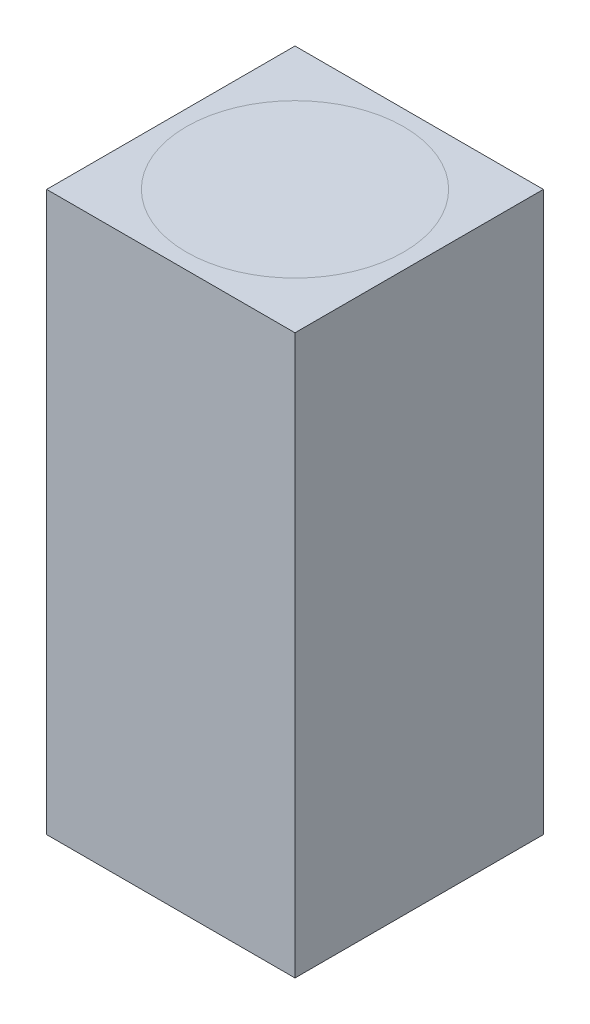
from build123d import *

# Parameters (mm, degrees)
SKETCH1_W           = 101.6
SKETCH1_H           = 101.6
SKETCH1_R           = 44.45
BOSS_EXTRUDE1_DEPTH = 215.9
SKETCH2_W           = 101.6
SKETCH2_H           = 101.6
BOSS_EXTRUDE2_DEPTH = 6.35
SKETCH4_W           = 101.6
SKETCH4_H           = 101.6
SKETCH4_R           = 44.45
BOSS_EXTRUDE4_DEPTH = 6.35
SKETCH5_R           = 44.45
BOSS_EXTRUDE5_DEPTH = 6.35


with BuildPart() as part:
    # Sketch1 → Boss-Extrude1 (new body)
    with BuildSketch(Plane(origin=(0, 0, 0), x_dir=(1, 0, 0), z_dir=(0, 1, 0))):
        with Locations((50.8, 50.8)):
            Rectangle(SKETCH1_W, SKETCH1_H)
        with Locations((50.8, 50.8)):
            Circle(SKETCH1_R, mode=Mode.SUBTRACT)
    extrude(amount=BOSS_EXTRUDE1_DEPTH)

    # Sketch2 → Boss-Extrude2 (add)
    with BuildSketch(Plane.XZ):
        with Locations((50.8, -50.8)):
            Rectangle(SKETCH2_W, SKETCH2_H)
    extrude(amount=BOSS_EXTRUDE2_DEPTH)

    # Sketch4 → Boss-Extrude4 (add)
    with BuildSketch(Plane(origin=(0, 215.9, 0), x_dir=(1, 0, 0), z_dir=(0, 1, 0))):
        with Locations((50.8, 50.8)):
            Rectangle(SKETCH4_W, SKETCH4_H)
        with Locations((50.8, 50.8)):
            Circle(SKETCH4_R, mode=Mode.SUBTRACT)
    extrude(amount=BOSS_EXTRUDE4_DEPTH)


with BuildPart() as body_2:
    # Sketch5 → Boss-Extrude5 (new body)
    with BuildSketch(Plane(origin=(0, 222.25, 0), x_dir=(1, 0, 0), z_dir=(0, 1, 0))):
        with Locations((50.8, 50.8)):
            Circle(SKETCH5_R)
    extrude(amount=-BOSS_EXTRUDE5_DEPTH)


solid = Compound([part.part, body_2.part])
